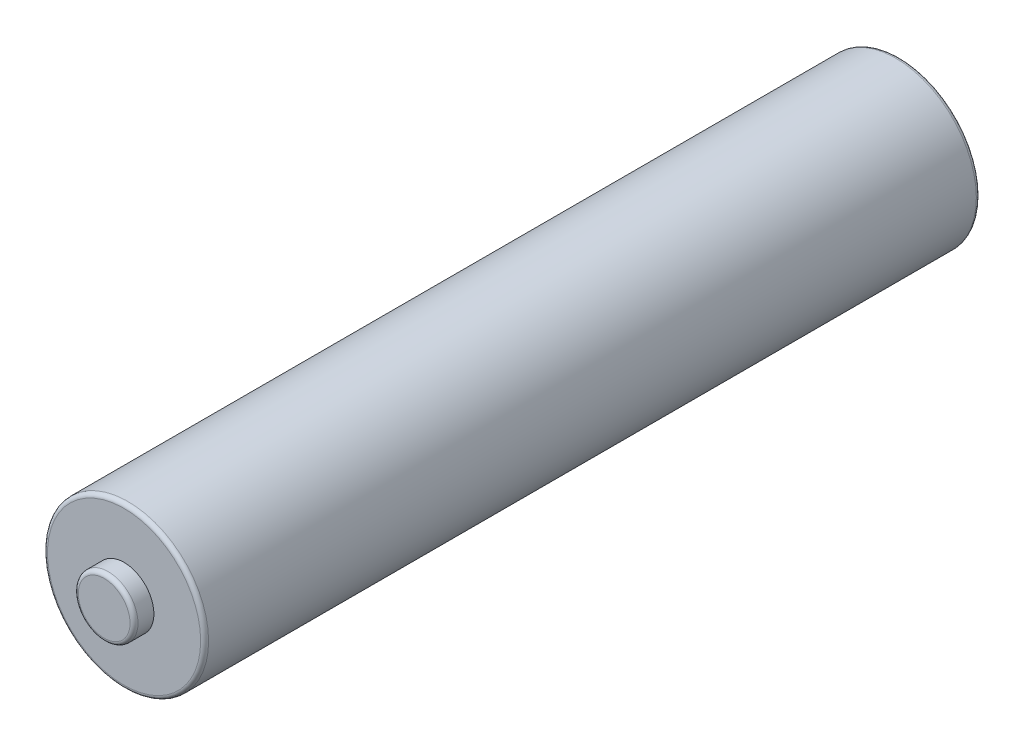
from build123d import *

# Parameters (mm, degrees)
SKIZZE1_R                       = 4.05
AUFSATZ_LINEAR_AUSTRAGEN1_DEPTH = 39
SKIZZE2_R                       = 1.5
AUFSATZ_LINEAR_AUSTRAGEN2_DEPTH = 1
VERRUNDUNG1_R                   = 0.2
VERRUNDUNG2_R                   = 0.2


with BuildPart() as part:
    # Skizze1 → Aufsatz-Linear austragen1 (new body)
    with BuildSketch(Plane.XY):
        Circle(SKIZZE1_R)
    extrude(amount=AUFSATZ_LINEAR_AUSTRAGEN1_DEPTH)

    # Skizze2 → Aufsatz-Linear austragen2 (add)
    with BuildSketch(Plane.XY.offset(39)):
        Circle(SKIZZE2_R)
    extrude(amount=AUFSATZ_LINEAR_AUSTRAGEN2_DEPTH)

    # Verrundung1
    verrundung1_edges = [part.edges().sort_by_distance(p)[0] for p in [
        (-1.5, 0, 40),
    ]]
    fillet(verrundung1_edges, radius=VERRUNDUNG1_R)

    # Verrundung2
    verrundung2_edges = [part.edges().sort_by_distance(p)[0] for p in [
        (-4.05, 0, 0),
        (-4.05, 0, 39),
    ]]
    fillet(verrundung2_edges, radius=VERRUNDUNG2_R)


solid = part.part
